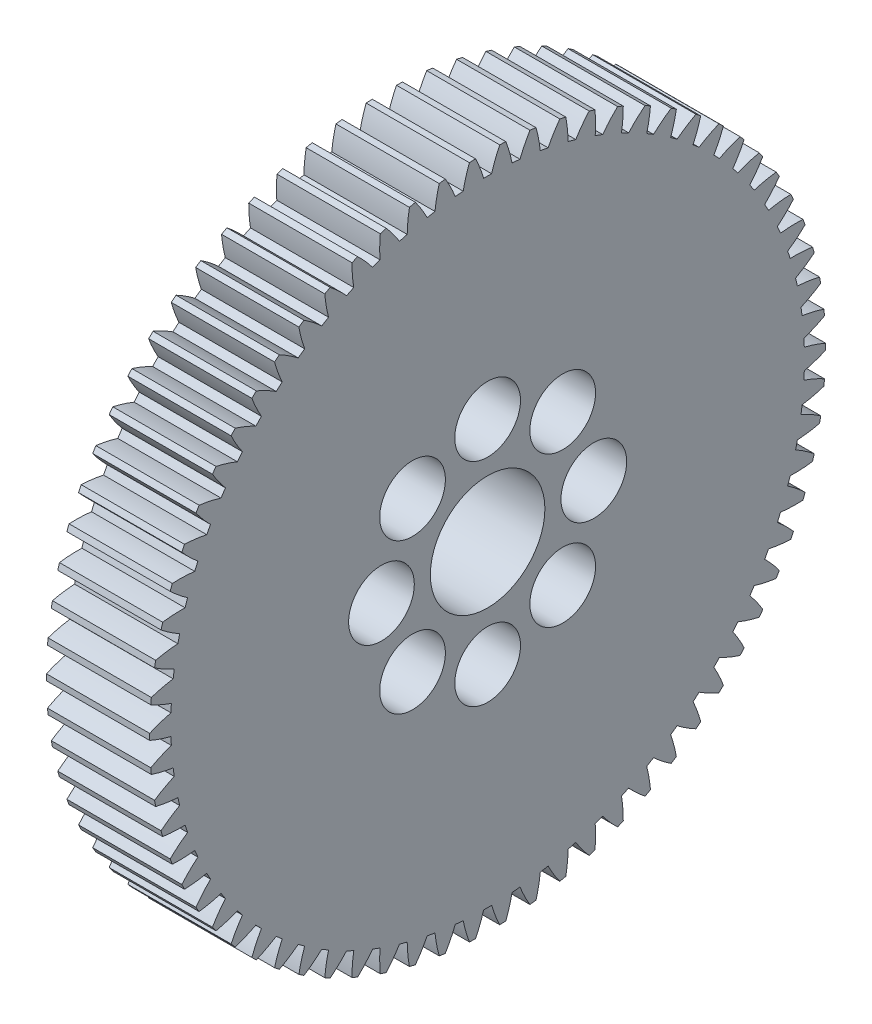
from build123d import *

# Parameters (mm, degrees)
SKETCH1_R           = 4
BOSS_EXTRUDE1_DEPTH = 6
SKETCH2_R           = 16
BOSS_EXTRUDE2_DEPTH = 12
CUT_EXTRUDE1_REACH  = 57.34
SKETCH3_R           = 6.1
CUT_EXTRUDE2_REACH  = 57.34
SKETCH4_R           = 2.1
SKETCH5_R           = 3.5
CUT_EXTRUDE3_DEPTH  = 4
SKETCH6_R           = 3.5
BOSS_EXTRUDE3_DEPTH = 5
SKETCH7_R           = 6.1
CUT_EXTRUDE4_DEPTH  = 10


with BuildPart() as part:
    # Sketch1 → Boss-Extrude1 (new body)
    with BuildSketch(Plane(origin=(10.107991725, 0, 0), x_dir=(0, 0, -1), z_dir=(1, 0, 0))):
        with BuildLine():
            ThreePointArc((-32.575364263, 13.320509527), (-31.755320174, 12.44838645), (-30.863768845, 11.649507738))
            ThreePointArc((-30.863768845, 11.649507738), (-31.033142796, 11.260036996), (-31.197602236, 10.868465692))
            ThreePointArc((-31.197602236, 10.868465692), (-32.391145489, 10.960799175), (-33.58821341, 10.950831147))
            ThreePointArc((-33.58821341, 10.950831147), (-33.704455343, 10.64532887), (-33.817918639, 10.338783753))
            ThreePointArc((-33.817918639, 10.338783753), (-32.922999297, 9.543679773), (-31.963426155, 8.827935157))
            ThreePointArc((-31.963426155, 8.827935157), (-32.097206368, 8.424849746), (-32.225903562, 8.020112763))
            ThreePointArc((-32.225903562, 8.020112763), (-33.422918671, 8.005086146), (-34.614274021, 7.887853905))
            ThreePointArc((-34.614274021, 7.887853905), (-34.702662985, 7.573161644), (-34.788191019, 7.257679816))
            ThreePointArc((-34.788191019, 7.257679816), (-33.825601787, 6.545996642), (-32.805732753, 5.919148876))
            ThreePointArc((-32.805732753, 5.919148876), (-32.902842108, 5.505694203), (-32.994740862, 5.091050244))
            ThreePointArc((-32.994740862, 5.091050244), (-34.185590164, 4.968784513), (-35.36164085, 4.745231944))
            ThreePointArc((-35.36164085, 4.745231944), (-35.42146519, 4.423883416), (-35.47836934, 4.102004952))
            ThreePointArc((-35.47836934, 4.102004952), (-34.455860422, 3.479472638), (-33.383906879, 2.946568733))
            ThreePointArc((-33.383906879, 2.946568733), (-33.44356351, 2.526073691), (-33.497923908, 2.104861226))
            ThreePointArc((-33.497923908, 2.104861226), (-34.673019385, 1.876340792), (-35.82429654, 1.54826781))
            ThreePointArc((-35.82429654, 1.54826781), (-35.855074584, 1.222850324), (-35.882896691, 0.897166799))
            ThreePointArc((-35.882896691, 0.897166799), (-34.808700727, 0.36879761), (-33.693293417, -0.065871806))
            ThreePointArc((-33.693293417, -0.065871806), (-33.715017003, -0.490021637), (-33.731401367, -0.914411253))
            ThreePointArc((-33.731401367, -0.914411253), (-34.881281842, -1.247346478), (-35.998516058, -1.677298424))
            ThreePointArc((-35.998516058, -1.677298424), (-36, -2.004164797), (-35.998516058, -2.33103117))
            ThreePointArc((-35.998516058, -2.33103117), (-34.881281842, -2.760983116), (-33.731401367, -3.09391834))
            ThreePointArc((-33.731401367, -3.09391834), (-33.715017003, -3.518307956), (-33.693293417, -3.942457788))
            ThreePointArc((-33.693293417, -3.942457788), (-34.808700727, -4.377127204), (-35.882896691, -4.905496392))
            ThreePointArc((-35.882896691, -4.905496392), (-35.855074584, -5.231179917), (-35.82429654, -5.556597403))
            ThreePointArc((-35.82429654, -5.556597403), (-34.673019385, -5.884670386), (-33.497923908, -6.11319082))
            ThreePointArc((-33.497923908, -6.11319082), (-33.44356351, -6.534403285), (-33.383906879, -6.954898327))
            ThreePointArc((-33.383906879, -6.954898327), (-34.455860422, -7.487802232), (-35.47836934, -8.110334545))
            ThreePointArc((-35.47836934, -8.110334545), (-35.42146519, -8.43221301), (-35.36164085, -8.753561538))
            ThreePointArc((-35.36164085, -8.753561538), (-34.185590164, -8.977114107), (-32.994740862, -9.099379838))
            ThreePointArc((-32.994740862, -9.099379838), (-32.902842108, -9.514023797), (-32.805732753, -9.92747847))
            ThreePointArc((-32.805732753, -9.92747847), (-33.825601787, -10.554326235), (-34.788191019, -11.26600941))
            ThreePointArc((-34.788191019, -11.26600941), (-34.702662985, -11.581491237), (-34.614274021, -11.896183498))
            ThreePointArc((-34.614274021, -11.896183498), (-33.422918671, -12.013415739), (-32.225903562, -12.028442357))
            ThreePointArc((-32.225903562, -12.028442357), (-32.097206368, -12.43317934), (-31.963426155, -12.836264751))
            ThreePointArc((-31.963426155, -12.836264751), (-32.922999297, -13.552009367), (-33.817918639, -14.347113347))
            ThreePointArc((-33.817918639, -14.347113347), (-33.704455343, -14.653658464), (-33.58821341, -14.959160741))
            ThreePointArc((-33.58821341, -14.959160741), (-32.391145489, -14.969128769), (-31.197602236, -14.876795286))
            ThreePointArc((-31.197602236, -14.876795286), (-31.033142796, -15.26836659), (-30.863768845, -15.657837331))
            ThreePointArc((-30.863768845, -15.657837331), (-31.755320174, -16.456716043), (-32.575364263, -17.32883912))
            ThreePointArc((-32.575364263, -17.32883912), (-32.434879244, -17.623979405), (-32.291720255, -17.917831973))
            ThreePointArc((-32.291720255, -17.917831973), (-31.09857785, -17.820455532), (-29.918116161, -17.621505364))
            ThreePointArc((-29.918116161, -17.621505364), (-29.719218605, -17.996758287), (-29.515614615, -18.369478569))
            ThreePointArc((-29.515614615, -18.369478569), (-30.331965886, -19.245059275), (-31.070532208, -20.187179627))
            ThreePointArc((-31.070532208, -20.187179627), (-30.90415657, -20.468538783), (-30.735233155, -20.748375715))
            ThreePointArc((-30.735233155, -20.748375715), (-29.555622747, -20.544438822), (-28.397747005, -20.240473799))
            ThreePointArc((-28.397747005, -20.240473799), (-28.16601274, -20.596387024), (-27.929818012, -20.949355923))
            ThreePointArc((-27.929818012, -20.949355923), (-28.664396442, -21.894588963), (-29.315538497, -22.899121189))
            ThreePointArc((-29.315538497, -22.899121189), (-29.124611797, -23.164433879), (-28.931284029, -23.428002091))
            ThreePointArc((-28.931284029, -23.428002091), (-27.774703149, -23.119146727), (-26.648735889, -22.712614196))
            ThreePointArc((-26.648735889, -22.712614196), (-26.386030702, -23.04632212), (-26.119146936, -23.376697738))
            ThreePointArc((-26.119146936, -23.376697738), (-26.766038134, -24.38397265), (-27.324513307, -25.442828849))
            ThreePointArc((-27.324513307, -25.442828849), (-27.110572776, -25.689958931), (-26.894397216, -25.935136327))
            ThreePointArc((-26.894397216, -25.935136327), (-25.770157972, -25.523849212), (-24.68516482, -25.018022335))
            ThreePointArc((-24.68516482, -25.018022335), (-24.393603859, -25.326838138), (-24.098179847, -25.631960484))
            ThreePointArc((-24.098179847, -25.631960484), (-24.652175424, -26.693167283), (-25.113487202, -27.797822167))
            ThreePointArc((-25.113487202, -27.797822167), (-24.878255364, -28.024779895), (-24.640972531, -28.249592451))
            ThreePointArc((-24.640972531, -28.249592451), (-23.558126636, -27.739185028), (-22.522843319, -27.138136426))
            ThreePointArc((-22.522843319, -27.138136426), (-22.204774062, -27.419573703), (-21.883188383, -27.696986113))
            ThreePointArc((-21.883188383, -27.696986113), (-22.339827893, -28.803580586), (-22.700262065, -29.945140123))
            ThreePointArc((-22.700262065, -29.945140123), (-22.445632867, -30.150098166), (-22.189153223, -30.352735823))
            ThreePointArc((-22.189153223, -30.352735823), (-21.156419116, -29.747317594), (-20.179181127, -29.055886555))
            ThreePointArc((-20.179181127, -29.055886555), (-19.83716448, -29.30767934), (-19.492006354, -29.555148251))
            ThreePointArc((-19.492006354, -29.555148251), (-19.847613203, -30.69822075), (-20.104267766, -31.867493774))
            ThreePointArc((-20.104267766, -31.867493774), (-19.832291332, -32.048801931), (-19.5586799, -32.227633171))
            ThreePointArc((-19.5586799, -32.227633171), (-18.584372549, -31.532078605), (-17.673048033, -30.755832126))
            ThreePointArc((-17.673048033, -30.755832126), (-17.309837713, -30.975953132), (-16.943886151, -31.19148607))
            ThreePointArc((-16.943886151, -31.19148607), (-17.195597202, -32.361833248), (-17.346405723, -33.54940546))
            ThreePointArc((-17.346405723, -33.54940546), (-17.059271849, -33.705603944), (-16.770731588, -33.859188922))
            ThreePointArc((-16.770731588, -33.859188922), (-15.862695541, -33.079098217), (-15.024621948, -32.224286178))
            ThreePointArc((-15.024621948, -32.224286178), (-14.643142311, -32.41096312), (-14.259343739, -32.59282474))
            ThreePointArc((-14.259343739, -32.59282474), (-14.405132363, -33.781023649), (-14.448880621, -34.977333416))
            ThreePointArc((-14.448880621, -34.977333416), (-14.14890114, -35.107164609), (-13.847755205, -35.23426675))
            ThreePointArc((-13.847755205, -35.23426675), (-13.013301437, -34.375920737), (-12.255226442, -33.449425582))
            ThreePointArc((-12.255226442, -33.449425582), (-11.858548938, -33.601155446), (-11.459993475, -33.747881507))
            ThreePointArc((-11.459993475, -33.747881507), (-11.498685869, -34.944365467), (-11.435021629, -36.139780806))
            ThreePointArc((-11.435021629, -36.139780806), (-11.124611797, -36.242199384), (-10.81328484, -36.341795335))
            ThreePointArc((-10.81328484, -36.341795335), (-10.059131881, -35.412104912), (-9.387159058, -34.421386236))
            ThreePointArc((-9.387159058, -34.421386236), (-8.978477501, -34.536947383), (-8.568374083, -34.647356531))
            ThreePointArc((-8.568374083, -34.647356531), (-8.499658717, -35.842492158), (-8.329094565, -37.027388288))
            ThreePointArc((-8.329094565, -37.027388288), (-8.010753622, -37.101569635), (-7.691752263, -37.17285751))
            ThreePointArc((-7.691752263, -37.17285751), (-7.023972109, -36.179307997), (-6.443511789, -35.132342483))
            ThreePointArc((-6.443511789, -35.132342483), (-6.026116643, -35.210804483), (-5.607767181, -35.284007769))
            ThreePointArc((-5.607767181, -35.284007769), (-5.432197311, -36.468172534), (-5.15610653, -37.633009368))
            ThreePointArc((-5.15610653, -37.633009368), (-4.832397569, -37.678356221), (-4.50829022, -37.720762049))
            ThreePointArc((-4.50829022, -37.720762049), (-3.932259444, -36.671352923), (-3.447985152, -35.576570123))
            ThreePointArc((-3.447985152, -35.576570123), (-3.025237036, -35.617301245), (-2.602009834, -35.65270928))
            ThreePointArc((-2.602009834, -35.65270928), (-2.320999046, -36.816368984), (-1.941604556, -37.95176794))
            ThreePointArc((-1.941604556, -37.95176794), (-1.615133893, -37.967915192), (-1.288530075, -37.981097549))
            ThreePointArc((-1.288530075, -37.981097549), (-0.808886539, -36.884278035), (-0.424697366, -35.750492496))
            ThreePointArc((-0.424697366, -35.750492496), (0, -35.753164797), (0.424697366, -35.750492496))
            ThreePointArc((0.424697366, -35.750492496), (0.808886539, -36.884278035), (1.288530075, -37.981097549))
            ThreePointArc((1.288530075, -37.981097549), (1.615133893, -37.967915192), (1.941604556, -37.95176794))
            ThreePointArc((1.941604556, -37.95176794), (2.320999046, -36.816368984), (2.602009834, -35.65270928))
            ThreePointArc((2.602009834, -35.65270928), (3.025237036, -35.617301245), (3.447985152, -35.576570123))
            ThreePointArc((3.447985152, -35.576570123), (3.932259444, -36.671352923), (4.50829022, -37.720762049))
            ThreePointArc((4.50829022, -37.720762049), (4.832397569, -37.678356221), (5.15610653, -37.633009368))
            ThreePointArc((5.15610653, -37.633009368), (5.432197311, -36.468172534), (5.607767181, -35.284007769))
            ThreePointArc((5.607767181, -35.284007769), (6.026116643, -35.210804483), (6.443511789, -35.132342483))
            ThreePointArc((6.443511789, -35.132342483), (7.023972109, -36.179307997), (7.691752263, -37.17285751))
            ThreePointArc((7.691752263, -37.17285751), (8.010753622, -37.101569635), (8.329094565, -37.027388288))
            ThreePointArc((8.329094565, -37.027388288), (8.499658717, -35.842492158), (8.568374083, -34.647356531))
            ThreePointArc((8.568374083, -34.647356531), (8.978477501, -34.536947383), (9.387159058, -34.421386236))
            ThreePointArc((9.387159058, -34.421386236), (10.059131881, -35.412104912), (10.81328484, -36.341795335))
            ThreePointArc((10.81328484, -36.341795335), (11.124611797, -36.242199384), (11.435021629, -36.139780806))
            ThreePointArc((11.435021629, -36.139780806), (11.498685869, -34.944365467), (11.459993475, -33.747881507))
            ThreePointArc((11.459993475, -33.747881507), (11.858548938, -33.601155446), (12.255226442, -33.449425582))
            ThreePointArc((12.255226442, -33.449425582), (13.013301437, -34.375920737), (13.847755205, -35.23426675))
            ThreePointArc((13.847755205, -35.23426675), (14.14890114, -35.107164609), (14.448880621, -34.977333416))
            ThreePointArc((14.448880621, -34.977333416), (14.405132363, -33.781023649), (14.259343739, -32.59282474))
            ThreePointArc((14.259343739, -32.59282474), (14.643142311, -32.41096312), (15.024621948, -32.224286178))
            ThreePointArc((15.024621948, -32.224286178), (15.862695541, -33.079098217), (16.770731588, -33.859188922))
            ThreePointArc((16.770731588, -33.859188922), (17.059271849, -33.705603944), (17.346405723, -33.54940546))
            ThreePointArc((17.346405723, -33.54940546), (17.195597202, -32.361833248), (16.943886151, -31.19148607))
            ThreePointArc((16.943886151, -31.19148607), (17.309837713, -30.975953132), (17.673048033, -30.755832126))
            ThreePointArc((17.673048033, -30.755832126), (18.584372549, -31.532078605), (19.5586799, -32.227633171))
            ThreePointArc((19.5586799, -32.227633171), (19.832291332, -32.048801931), (20.104267766, -31.867493774))
            ThreePointArc((20.104267766, -31.867493774), (19.847613203, -30.69822075), (19.492006354, -29.555148251))
            ThreePointArc((19.492006354, -29.555148251), (19.83716448, -29.30767934), (20.179181127, -29.055886555))
            ThreePointArc((20.179181127, -29.055886555), (21.156419116, -29.747317594), (22.189153223, -30.352735823))
            ThreePointArc((22.189153223, -30.352735823), (22.445632867, -30.150098166), (22.700262065, -29.945140123))
            ThreePointArc((22.700262065, -29.945140123), (22.339827893, -28.803580586), (21.883188383, -27.696986113))
            ThreePointArc((21.883188383, -27.696986113), (22.204774062, -27.419573703), (22.522843319, -27.138136426))
            ThreePointArc((22.522843319, -27.138136426), (23.558126636, -27.739185028), (24.640972531, -28.249592451))
            ThreePointArc((24.640972531, -28.249592451), (24.878255364, -28.024779895), (25.113487202, -27.797822167))
            ThreePointArc((25.113487202, -27.797822167), (24.652175424, -26.693167283), (24.098179847, -25.631960484))
            ThreePointArc((24.098179847, -25.631960484), (24.393603859, -25.326838138), (24.68516482, -25.018022335))
            ThreePointArc((24.68516482, -25.018022335), (25.770157972, -25.523849212), (26.894397216, -25.935136327))
            ThreePointArc((26.894397216, -25.935136327), (27.110572776, -25.689958931), (27.324513307, -25.442828849))
            ThreePointArc((27.324513307, -25.442828849), (26.766038134, -24.38397265), (26.119146936, -23.376697738))
            ThreePointArc((26.119146936, -23.376697738), (26.386030702, -23.04632212), (26.648735889, -22.712614196))
            ThreePointArc((26.648735889, -22.712614196), (27.774703149, -23.119146727), (28.931284029, -23.428002091))
            ThreePointArc((28.931284029, -23.428002091), (29.124611797, -23.164433879), (29.315538497, -22.899121189))
            ThreePointArc((29.315538497, -22.899121189), (28.664396442, -21.894588963), (27.929818012, -20.949355923))
            ThreePointArc((27.929818012, -20.949355923), (28.16601274, -20.596387024), (28.397747005, -20.240473799))
            ThreePointArc((28.397747005, -20.240473799), (29.555622747, -20.544438822), (30.735233155, -20.748375715))
            ThreePointArc((30.735233155, -20.748375715), (30.90415657, -20.468538783), (31.070532208, -20.187179627))
            ThreePointArc((31.070532208, -20.187179627), (30.331965886, -19.245059275), (29.515614615, -18.369478569))
            ThreePointArc((29.515614615, -18.369478569), (29.719218605, -17.996758287), (29.918116161, -17.621505364))
            ThreePointArc((29.918116161, -17.621505364), (31.09857785, -17.820455532), (32.291720255, -17.917831973))
            ThreePointArc((32.291720255, -17.917831973), (32.434879244, -17.623979405), (32.575364263, -17.32883912))
            ThreePointArc((32.575364263, -17.32883912), (31.755320174, -16.456716043), (30.863768845, -15.657837331))
            ThreePointArc((30.863768845, -15.657837331), (31.033142796, -15.26836659), (31.197602236, -14.876795286))
            ThreePointArc((31.197602236, -14.876795286), (32.391145489, -14.969128769), (33.58821341, -14.959160741))
            ThreePointArc((33.58821341, -14.959160741), (33.704455343, -14.653658464), (33.817918639, -14.347113347))
            ThreePointArc((33.817918639, -14.347113347), (32.922999297, -13.552009367), (31.963426155, -12.836264751))
            ThreePointArc((31.963426155, -12.836264751), (32.097206368, -12.43317934), (32.225903562, -12.028442357))
            ThreePointArc((32.225903562, -12.028442357), (33.422918671, -12.013415739), (34.614274021, -11.896183498))
            ThreePointArc((34.614274021, -11.896183498), (34.702662985, -11.581491237), (34.788191019, -11.26600941))
            ThreePointArc((34.788191019, -11.26600941), (33.825601787, -10.554326235), (32.805732753, -9.92747847))
            ThreePointArc((32.805732753, -9.92747847), (32.902842108, -9.514023797), (32.994740862, -9.099379838))
            ThreePointArc((32.994740862, -9.099379838), (34.185590164, -8.977114107), (35.36164085, -8.753561538))
            ThreePointArc((35.36164085, -8.753561538), (35.42146519, -8.43221301), (35.47836934, -8.110334545))
            ThreePointArc((35.47836934, -8.110334545), (34.455860422, -7.487802232), (33.383906879, -6.954898327))
            ThreePointArc((33.383906879, -6.954898327), (33.44356351, -6.534403285), (33.497923908, -6.11319082))
            ThreePointArc((33.497923908, -6.11319082), (34.673019385, -5.884670386), (35.82429654, -5.556597403))
            ThreePointArc((35.82429654, -5.556597403), (35.855074584, -5.231179917), (35.882896691, -4.905496392))
            ThreePointArc((35.882896691, -4.905496392), (34.808700727, -4.377127204), (33.693293417, -3.942457788))
            ThreePointArc((33.693293417, -3.942457788), (33.715017003, -3.518307956), (33.731401367, -3.09391834))
            ThreePointArc((33.731401367, -3.09391834), (34.881281842, -2.760983116), (35.998516058, -2.33103117))
            ThreePointArc((35.998516058, -2.33103117), (36, -2.004164797), (35.998516058, -1.677298424))
            ThreePointArc((35.998516058, -1.677298424), (34.881281842, -1.247346478), (33.731401367, -0.914411253))
            ThreePointArc((33.731401367, -0.914411253), (33.715017003, -0.490021637), (33.693293417, -0.065871806))
            ThreePointArc((33.693293417, -0.065871806), (34.808700727, 0.36879761), (35.882896691, 0.897166799))
            ThreePointArc((35.882896691, 0.897166799), (35.855074584, 1.222850324), (35.82429654, 1.54826781))
            ThreePointArc((35.82429654, 1.54826781), (34.673019385, 1.876340792), (33.497923908, 2.104861226))
            ThreePointArc((33.497923908, 2.104861226), (33.44356351, 2.526073691), (33.383906879, 2.946568733))
            ThreePointArc((33.383906879, 2.946568733), (34.455860422, 3.479472638), (35.47836934, 4.102004952))
            ThreePointArc((35.47836934, 4.102004952), (35.42146519, 4.423883416), (35.36164085, 4.745231944))
            ThreePointArc((35.36164085, 4.745231944), (34.185590164, 4.968784513), (32.994740862, 5.091050244))
            ThreePointArc((32.994740862, 5.091050244), (32.902842108, 5.505694203), (32.805732753, 5.919148876))
            ThreePointArc((32.805732753, 5.919148876), (33.825601787, 6.545996642), (34.788191019, 7.257679816))
            ThreePointArc((34.788191019, 7.257679816), (34.702662985, 7.573161644), (34.614274021, 7.887853905))
            ThreePointArc((34.614274021, 7.887853905), (33.422918671, 8.005086146), (32.225903562, 8.020112763))
            ThreePointArc((32.225903562, 8.020112763), (32.097206368, 8.424849746), (31.963426155, 8.827935157))
            ThreePointArc((31.963426155, 8.827935157), (32.922999297, 9.543679773), (33.817918639, 10.338783753))
            ThreePointArc((33.817918639, 10.338783753), (33.704455343, 10.64532887), (33.58821341, 10.950831147))
            ThreePointArc((33.58821341, 10.950831147), (32.391145489, 10.960799175), (31.197602236, 10.868465692))
            ThreePointArc((31.197602236, 10.868465692), (31.033142796, 11.260036996), (30.863768845, 11.649507738))
            ThreePointArc((30.863768845, 11.649507738), (31.755320174, 12.44838645), (32.575364263, 13.320509527))
            ThreePointArc((32.575364263, 13.320509527), (32.434879244, 13.615649811), (32.291720255, 13.909502379))
            ThreePointArc((32.291720255, 13.909502379), (31.09857785, 13.812125938), (29.918116161, 13.613175771))
            ThreePointArc((29.918116161, 13.613175771), (29.719218605, 13.988428693), (29.515614615, 14.361148976))
            ThreePointArc((29.515614615, 14.361148976), (30.331965886, 15.236729682), (31.070532208, 16.178850033))
            ThreePointArc((31.070532208, 16.178850033), (30.90415657, 16.46020919), (30.735233155, 16.740046121))
            ThreePointArc((30.735233155, 16.740046121), (29.555622747, 16.536109228), (28.397747005, 16.232144205))
            ThreePointArc((28.397747005, 16.232144205), (28.16601274, 16.58805743), (27.929818012, 16.94102633))
            ThreePointArc((27.929818012, 16.94102633), (28.664396442, 17.886259369), (29.315538497, 18.890791595))
            ThreePointArc((29.315538497, 18.890791595), (29.124611797, 19.156104286), (28.931284029, 19.419672497))
            ThreePointArc((28.931284029, 19.419672497), (27.774703149, 19.110817133), (26.648735889, 18.704284602))
            ThreePointArc((26.648735889, 18.704284602), (26.386030702, 19.037992526), (26.119146936, 19.368368144))
            ThreePointArc((26.119146936, 19.368368144), (26.766038134, 20.375643056), (27.324513307, 21.434499255))
            ThreePointArc((27.324513307, 21.434499255), (27.110572776, 21.681629337), (26.894397216, 21.926806733))
            ThreePointArc((26.894397216, 21.926806733), (25.770157972, 21.515519619), (24.68516482, 21.009692742))
            ThreePointArc((24.68516482, 21.009692742), (24.393603859, 21.318508544), (24.098179847, 21.623630891))
            ThreePointArc((24.098179847, 21.623630891), (24.652175424, 22.68483769), (25.113487202, 23.789492573))
            ThreePointArc((25.113487202, 23.789492573), (24.878255364, 24.016450301), (24.640972531, 24.241262857))
            ThreePointArc((24.640972531, 24.241262857), (23.558126636, 23.730855435), (22.522843319, 23.129806832))
            ThreePointArc((22.522843319, 23.129806832), (22.204774062, 23.411244109), (21.883188383, 23.688656519))
            ThreePointArc((21.883188383, 23.688656519), (22.339827893, 24.795250992), (22.700262065, 25.936810529))
            ThreePointArc((22.700262065, 25.936810529), (22.445632867, 26.141768572), (22.189153223, 26.34440623))
            ThreePointArc((22.189153223, 26.34440623), (21.156419116, 25.738988), (20.179181127, 25.047556961))
            ThreePointArc((20.179181127, 25.047556961), (19.83716448, 25.299349746), (19.492006354, 25.546818657))
            ThreePointArc((19.492006354, 25.546818657), (19.847613203, 26.689891156), (20.104267766, 27.85916418))
            ThreePointArc((20.104267766, 27.85916418), (19.832291332, 28.040472337), (19.5586799, 28.219303577))
            ThreePointArc((19.5586799, 28.219303577), (18.584372549, 27.523749011), (17.673048033, 26.747502533))
            ThreePointArc((17.673048033, 26.747502533), (17.309837713, 26.967623538), (16.943886151, 27.183156476))
            ThreePointArc((16.943886151, 27.183156476), (17.195597202, 28.353503654), (17.346405723, 29.541075866))
            ThreePointArc((17.346405723, 29.541075866), (17.059271849, 29.69727435), (16.770731588, 29.850859328))
            ThreePointArc((16.770731588, 29.850859328), (15.862695541, 29.070768623), (15.024621948, 28.215956585))
            ThreePointArc((15.024621948, 28.215956585), (14.643142311, 28.402633526), (14.259343739, 28.584495147))
            ThreePointArc((14.259343739, 28.584495147), (14.405132363, 29.772694055), (14.448880621, 30.969003822))
            ThreePointArc((14.448880621, 30.969003822), (14.14890114, 31.098835015), (13.847755205, 31.225937156))
            ThreePointArc((13.847755205, 31.225937156), (13.013301437, 30.367591143), (12.255226442, 29.441095989))
            ThreePointArc((12.255226442, 29.441095989), (11.858548938, 29.592825852), (11.459993475, 29.739551913))
            ThreePointArc((11.459993475, 29.739551913), (11.498685869, 30.936035873), (11.435021629, 32.131451213))
            ThreePointArc((11.435021629, 32.131451213), (11.124611797, 32.23386979), (10.81328484, 32.333465741))
            ThreePointArc((10.81328484, 32.333465741), (10.059131881, 31.403775318), (9.387159058, 30.413056642))
            ThreePointArc((9.387159058, 30.413056642), (8.978477501, 30.528617789), (8.568374083, 30.639026937))
            ThreePointArc((8.568374083, 30.639026937), (8.499658717, 31.834162564), (8.329094565, 33.019058694))
            ThreePointArc((8.329094565, 33.019058694), (8.010753622, 33.093240042), (7.691752263, 33.164527916))
            ThreePointArc((7.691752263, 33.164527916), (7.023972109, 32.170978403), (6.443511789, 31.12401289))
            ThreePointArc((6.443511789, 31.12401289), (6.026116643, 31.202474889), (5.607767181, 31.275678175))
            ThreePointArc((5.607767181, 31.275678175), (5.432197311, 32.45984294), (5.15610653, 33.624679774))
            ThreePointArc((5.15610653, 33.624679774), (4.832397569, 33.670026627), (4.50829022, 33.712432456))
            ThreePointArc((4.50829022, 33.712432456), (3.932259444, 32.663023329), (3.447985152, 31.568240529))
            ThreePointArc((3.447985152, 31.568240529), (3.025237036, 31.608971651), (2.602009834, 31.644379686))
            ThreePointArc((2.602009834, 31.644379686), (2.320999046, 32.80803939), (1.941604556, 33.943438346))
            ThreePointArc((1.941604556, 33.943438346), (1.615133893, 33.959585599), (1.288530075, 33.972767955))
            ThreePointArc((1.288530075, 33.972767955), (0.808886539, 32.875948441), (0.424697366, 31.742162902))
            ThreePointArc((0.424697366, 31.742162902), (0, 31.744835203), (-0.424697366, 31.742162902))
            ThreePointArc((-0.424697366, 31.742162902), (-0.808886539, 32.875948441), (-1.288530075, 33.972767955))
            ThreePointArc((-1.288530075, 33.972767955), (-1.615133893, 33.959585599), (-1.941604556, 33.943438346))
            ThreePointArc((-1.941604556, 33.943438346), (-2.320999046, 32.80803939), (-2.602009834, 31.644379686))
            ThreePointArc((-2.602009834, 31.644379686), (-3.025237036, 31.608971651), (-3.447985152, 31.568240529))
            ThreePointArc((-3.447985152, 31.568240529), (-3.932259444, 32.663023329), (-4.50829022, 33.712432456))
            ThreePointArc((-4.50829022, 33.712432456), (-4.832397569, 33.670026627), (-5.15610653, 33.624679774))
            ThreePointArc((-5.15610653, 33.624679774), (-5.432197311, 32.45984294), (-5.607767181, 31.275678175))
            ThreePointArc((-5.607767181, 31.275678175), (-6.026116643, 31.202474889), (-6.443511789, 31.12401289))
            ThreePointArc((-6.443511789, 31.12401289), (-7.023972109, 32.170978403), (-7.691752263, 33.164527916))
            ThreePointArc((-7.691752263, 33.164527916), (-8.010753622, 33.093240042), (-8.329094565, 33.019058694))
            ThreePointArc((-8.329094565, 33.019058694), (-8.499658717, 31.834162564), (-8.568374083, 30.639026937))
            ThreePointArc((-8.568374083, 30.639026937), (-8.978477501, 30.528617789), (-9.387159058, 30.413056642))
            ThreePointArc((-9.387159058, 30.413056642), (-10.059131881, 31.403775318), (-10.81328484, 32.333465741))
            ThreePointArc((-10.81328484, 32.333465741), (-11.124611797, 32.23386979), (-11.435021629, 32.131451213))
            ThreePointArc((-11.435021629, 32.131451213), (-11.498685869, 30.936035873), (-11.459993475, 29.739551913))
            ThreePointArc((-11.459993475, 29.739551913), (-11.858548938, 29.592825852), (-12.255226442, 29.441095989))
            ThreePointArc((-12.255226442, 29.441095989), (-13.013301437, 30.367591143), (-13.847755205, 31.225937156))
            ThreePointArc((-13.847755205, 31.225937156), (-14.14890114, 31.098835015), (-14.448880621, 30.969003822))
            ThreePointArc((-14.448880621, 30.969003822), (-14.405132363, 29.772694055), (-14.259343739, 28.584495147))
            ThreePointArc((-14.259343739, 28.584495147), (-14.643142311, 28.402633526), (-15.024621948, 28.215956585))
            ThreePointArc((-15.024621948, 28.215956585), (-15.862695541, 29.070768623), (-16.770731588, 29.850859328))
            ThreePointArc((-16.770731588, 29.850859328), (-17.059271849, 29.69727435), (-17.346405723, 29.541075866))
            ThreePointArc((-17.346405723, 29.541075866), (-17.195597202, 28.353503654), (-16.943886151, 27.183156476))
            ThreePointArc((-16.943886151, 27.183156476), (-17.309837713, 26.967623538), (-17.673048033, 26.747502533))
            ThreePointArc((-17.673048033, 26.747502533), (-18.584372549, 27.523749011), (-19.5586799, 28.219303577))
            ThreePointArc((-19.5586799, 28.219303577), (-19.832291332, 28.040472337), (-20.104267766, 27.85916418))
            ThreePointArc((-20.104267766, 27.85916418), (-19.847613203, 26.689891156), (-19.492006354, 25.546818657))
            ThreePointArc((-19.492006354, 25.546818657), (-19.83716448, 25.299349746), (-20.179181127, 25.047556961))
            ThreePointArc((-20.179181127, 25.047556961), (-21.156419116, 25.738988), (-22.189153223, 26.34440623))
            ThreePointArc((-22.189153223, 26.34440623), (-22.445632867, 26.141768572), (-22.700262065, 25.936810529))
            ThreePointArc((-22.700262065, 25.936810529), (-22.339827893, 24.795250992), (-21.883188383, 23.688656519))
            ThreePointArc((-21.883188383, 23.688656519), (-22.204774062, 23.411244109), (-22.522843319, 23.129806832))
            ThreePointArc((-22.522843319, 23.129806832), (-23.558126636, 23.730855435), (-24.640972531, 24.241262857))
            ThreePointArc((-24.640972531, 24.241262857), (-24.878255364, 24.016450301), (-25.113487202, 23.789492573))
            ThreePointArc((-25.113487202, 23.789492573), (-24.652175424, 22.68483769), (-24.098179847, 21.623630891))
            ThreePointArc((-24.098179847, 21.623630891), (-24.393603859, 21.318508544), (-24.68516482, 21.009692742))
            ThreePointArc((-24.68516482, 21.009692742), (-25.770157972, 21.515519619), (-26.894397216, 21.926806733))
            ThreePointArc((-26.894397216, 21.926806733), (-27.110572776, 21.681629337), (-27.324513307, 21.434499255))
            ThreePointArc((-27.324513307, 21.434499255), (-26.766038134, 20.375643056), (-26.119146936, 19.368368144))
            ThreePointArc((-26.119146936, 19.368368144), (-26.386030702, 19.037992526), (-26.648735889, 18.704284602))
            ThreePointArc((-26.648735889, 18.704284602), (-27.774703149, 19.110817133), (-28.931284029, 19.419672497))
            ThreePointArc((-28.931284029, 19.419672497), (-29.124611797, 19.156104286), (-29.315538497, 18.890791595))
            ThreePointArc((-29.315538497, 18.890791595), (-28.664396442, 17.886259369), (-27.929818012, 16.94102633))
            ThreePointArc((-27.929818012, 16.94102633), (-28.16601274, 16.58805743), (-28.397747005, 16.232144205))
            ThreePointArc((-28.397747005, 16.232144205), (-29.555622747, 16.536109228), (-30.735233155, 16.740046121))
            ThreePointArc((-30.735233155, 16.740046121), (-30.90415657, 16.46020919), (-31.070532208, 16.178850033))
            ThreePointArc((-31.070532208, 16.178850033), (-30.331965886, 15.236729682), (-29.515614615, 14.361148976))
            ThreePointArc((-29.515614615, 14.361148976), (-29.719218605, 13.988428693), (-29.918116161, 13.613175771))
            ThreePointArc((-29.918116161, 13.613175771), (-31.09857785, 13.812125938), (-32.291720255, 13.909502379))
            ThreePointArc((-32.291720255, 13.909502379), (-32.434879244, 13.615649811), (-32.575364263, 13.320509527))
        make_face()
        with Locations((0, -2.004164797)):
            Circle(SKETCH1_R, mode=Mode.SUBTRACT)
    extrude(amount=-BOSS_EXTRUDE1_DEPTH)

    # Sketch2 → Boss-Extrude2 (add)
    with BuildSketch(Plane.ZY.offset(-4.107991725)):
        with Locations((0, -2.004164797)):
            Circle(SKETCH2_R)
    extrude(amount=BOSS_EXTRUDE2_DEPTH)

    # Sketch3 → Cut-Extrude1 (cut, up to next)
    with BuildSketch(Plane.ZY.offset(7.892008275), mode=Mode.PRIVATE) as cut_extrude1_sk1:
        with Locations((0, -2.004164797)):
            Circle(SKETCH3_R)
    cut_extrude1_tool1 = extrude(cut_extrude1_sk1.sketch, amount=-CUT_EXTRUDE1_REACH, mode=Mode.PRIVATE) & part.part
    add(cut_extrude1_tool1.solids().sort_by_distance((-7.892008, -2.004165, 0))[0], mode=Mode.SUBTRACT)

    # Sketch4 → Cut-Extrude2 (cut, up to next)
    with BuildSketch(Plane.ZY.offset(7.892008275), mode=Mode.PRIVATE) as cut_extrude2_sk1:
        with Locations((11.31, -2.004164797)):
            Circle(SKETCH4_R)
    cut_extrude2_tool1 = extrude(cut_extrude2_sk1.sketch, amount=-CUT_EXTRUDE2_REACH, mode=Mode.PRIVATE) & part.part
    # Sketch4 → Cut-Extrude2 (cut, up to next)
    with BuildSketch(Plane.ZY.offset(7.892008275), mode=Mode.PRIVATE) as cut_extrude2_sk2:
        with Locations((7.997377695, -10.001542492)):
            Circle(SKETCH4_R)
    cut_extrude2_tool2 = extrude(cut_extrude2_sk2.sketch, amount=-CUT_EXTRUDE2_REACH, mode=Mode.PRIVATE) & part.part
    # Sketch4 → Cut-Extrude2 (cut, up to next)
    with BuildSketch(Plane.ZY.offset(7.892008275), mode=Mode.PRIVATE) as cut_extrude2_sk3:
        with Locations((0, -13.314164797)):
            Circle(SKETCH4_R)
    cut_extrude2_tool3 = extrude(cut_extrude2_sk3.sketch, amount=-CUT_EXTRUDE2_REACH, mode=Mode.PRIVATE) & part.part
    # Sketch4 → Cut-Extrude2 (cut, up to next)
    with BuildSketch(Plane.ZY.offset(7.892008275), mode=Mode.PRIVATE) as cut_extrude2_sk4:
        with Locations((-7.997377695, -10.001542492)):
            Circle(SKETCH4_R)
    cut_extrude2_tool4 = extrude(cut_extrude2_sk4.sketch, amount=-CUT_EXTRUDE2_REACH, mode=Mode.PRIVATE) & part.part
    # Sketch4 → Cut-Extrude2 (cut, up to next)
    with BuildSketch(Plane.ZY.offset(7.892008275), mode=Mode.PRIVATE) as cut_extrude2_sk5:
        with Locations((-11.31, -2.004164797)):
            Circle(SKETCH4_R)
    cut_extrude2_tool5 = extrude(cut_extrude2_sk5.sketch, amount=-CUT_EXTRUDE2_REACH, mode=Mode.PRIVATE) & part.part
    # Sketch4 → Cut-Extrude2 (cut, up to next)
    with BuildSketch(Plane.ZY.offset(7.892008275), mode=Mode.PRIVATE) as cut_extrude2_sk6:
        with Locations((-7.997377695, 5.993212898)):
            Circle(SKETCH4_R)
    cut_extrude2_tool6 = extrude(cut_extrude2_sk6.sketch, amount=-CUT_EXTRUDE2_REACH, mode=Mode.PRIVATE) & part.part
    # Sketch4 → Cut-Extrude2 (cut, up to next)
    with BuildSketch(Plane.ZY.offset(7.892008275), mode=Mode.PRIVATE) as cut_extrude2_sk7:
        with Locations((0, 9.305835203)):
            Circle(SKETCH4_R)
    cut_extrude2_tool7 = extrude(cut_extrude2_sk7.sketch, amount=-CUT_EXTRUDE2_REACH, mode=Mode.PRIVATE) & part.part
    # Sketch4 → Cut-Extrude2 (cut, up to next)
    with BuildSketch(Plane.ZY.offset(7.892008275), mode=Mode.PRIVATE) as cut_extrude2_sk8:
        with Locations((7.997377695, 5.993212898)):
            Circle(SKETCH4_R)
    cut_extrude2_tool8 = extrude(cut_extrude2_sk8.sketch, amount=-CUT_EXTRUDE2_REACH, mode=Mode.PRIVATE) & part.part
    add(cut_extrude2_tool1.solids().sort_by_distance((-7.892008, -2.004165, 11.31))[0], mode=Mode.SUBTRACT)
    add(cut_extrude2_tool2.solids().sort_by_distance((-7.892008, -10.001542, 7.997378))[0], mode=Mode.SUBTRACT)
    add(cut_extrude2_tool3.solids().sort_by_distance((-7.892008, -13.314165, 0))[0], mode=Mode.SUBTRACT)
    add(cut_extrude2_tool4.solids().sort_by_distance((-7.892008, -10.001542, -7.997378))[0], mode=Mode.SUBTRACT)
    add(cut_extrude2_tool5.solids().sort_by_distance((-7.892008, -2.004165, -11.31))[0], mode=Mode.SUBTRACT)
    add(cut_extrude2_tool6.solids().sort_by_distance((-7.892008, 5.993213, -7.997378))[0], mode=Mode.SUBTRACT)
    add(cut_extrude2_tool7.solids().sort_by_distance((-7.892008, 9.305835, 0))[0], mode=Mode.SUBTRACT)
    add(cut_extrude2_tool8.solids().sort_by_distance((-7.892008, 5.993213, 7.997378))[0], mode=Mode.SUBTRACT)

    # Sketch5 → Cut-Extrude3 (cut)
    with BuildSketch(Plane(origin=(10.107991725, 0, 0), x_dir=(0, 0, -1), z_dir=(1, 0, 0))):
        with Locations((0, 9.305835203)):
            Circle(SKETCH5_R)
        with Locations((7.997377695, 5.993212898)):
            Circle(SKETCH5_R)
        with Locations((11.31, -2.004164797)):
            Circle(SKETCH5_R)
        with Locations((7.997377695, -10.001542492)):
            Circle(SKETCH5_R)
        with Locations((0, -13.314164797)):
            Circle(SKETCH5_R)
        with Locations((-7.997377695, -10.001542492)):
            Circle(SKETCH5_R)
        with Locations((-11.31, -2.004164797)):
            Circle(SKETCH5_R)
        with Locations((-7.997377695, 5.993212898)):
            Circle(SKETCH5_R)
    extrude(amount=-CUT_EXTRUDE3_DEPTH, mode=Mode.SUBTRACT)

    # Sketch6 → Boss-Extrude3 (add)
    with BuildSketch(Plane(origin=(10.107991725, 0, 0), x_dir=(0, 0, -1), z_dir=(1, 0, 0))):
        with BuildLine():
            ThreePointArc((-32.575364263, 13.320509527), (-31.755320174, 12.44838645), (-30.863768845, 11.649507738))
            ThreePointArc((-30.863768845, 11.649507738), (-31.033142796, 11.260036996), (-31.197602236, 10.868465692))
            ThreePointArc((-31.197602236, 10.868465692), (-32.391145489, 10.960799175), (-33.58821341, 10.950831147))
            ThreePointArc((-33.58821341, 10.950831147), (-33.704455343, 10.64532887), (-33.817918639, 10.338783753))
            ThreePointArc((-33.817918639, 10.338783753), (-32.922999297, 9.543679773), (-31.963426155, 8.827935157))
            ThreePointArc((-31.963426155, 8.827935157), (-32.097206368, 8.424849746), (-32.225903562, 8.020112763))
            ThreePointArc((-32.225903562, 8.020112763), (-33.422918671, 8.005086146), (-34.614274021, 7.887853905))
            ThreePointArc((-34.614274021, 7.887853905), (-34.702662985, 7.573161644), (-34.788191019, 7.257679816))
            ThreePointArc((-34.788191019, 7.257679816), (-33.825601787, 6.545996642), (-32.805732753, 5.919148876))
            ThreePointArc((-32.805732753, 5.919148876), (-32.902842108, 5.505694203), (-32.994740862, 5.091050244))
            ThreePointArc((-32.994740862, 5.091050244), (-34.185590164, 4.968784513), (-35.36164085, 4.745231944))
            ThreePointArc((-35.36164085, 4.745231944), (-35.42146519, 4.423883416), (-35.47836934, 4.102004952))
            ThreePointArc((-35.47836934, 4.102004952), (-34.455860422, 3.479472638), (-33.383906879, 2.946568733))
            ThreePointArc((-33.383906879, 2.946568733), (-33.44356351, 2.526073691), (-33.497923908, 2.104861226))
            ThreePointArc((-33.497923908, 2.104861226), (-34.673019385, 1.876340792), (-35.82429654, 1.54826781))
            ThreePointArc((-35.82429654, 1.54826781), (-35.855074584, 1.222850324), (-35.882896691, 0.897166799))
            ThreePointArc((-35.882896691, 0.897166799), (-34.808700727, 0.36879761), (-33.693293417, -0.065871806))
            ThreePointArc((-33.693293417, -0.065871806), (-33.715017003, -0.490021637), (-33.731401367, -0.914411253))
            ThreePointArc((-33.731401367, -0.914411253), (-34.881281842, -1.247346478), (-35.998516058, -1.677298424))
            ThreePointArc((-35.998516058, -1.677298424), (-36, -2.004164797), (-35.998516058, -2.33103117))
            ThreePointArc((-35.998516058, -2.33103117), (-34.881281842, -2.760983116), (-33.731401367, -3.09391834))
            ThreePointArc((-33.731401367, -3.09391834), (-33.715017003, -3.518307956), (-33.693293417, -3.942457788))
            ThreePointArc((-33.693293417, -3.942457788), (-34.808700727, -4.377127204), (-35.882896691, -4.905496392))
            ThreePointArc((-35.882896691, -4.905496392), (-35.855074584, -5.231179917), (-35.82429654, -5.556597403))
            ThreePointArc((-35.82429654, -5.556597403), (-34.673019385, -5.884670386), (-33.497923908, -6.11319082))
            ThreePointArc((-33.497923908, -6.11319082), (-33.44356351, -6.534403285), (-33.383906879, -6.954898327))
            ThreePointArc((-33.383906879, -6.954898327), (-34.455860422, -7.487802232), (-35.47836934, -8.110334545))
            ThreePointArc((-35.47836934, -8.110334545), (-35.42146519, -8.43221301), (-35.36164085, -8.753561538))
            ThreePointArc((-35.36164085, -8.753561538), (-34.185590164, -8.977114107), (-32.994740862, -9.099379838))
            ThreePointArc((-32.994740862, -9.099379838), (-32.902842108, -9.514023797), (-32.805732753, -9.92747847))
            ThreePointArc((-32.805732753, -9.92747847), (-33.825601787, -10.554326235), (-34.788191019, -11.26600941))
            ThreePointArc((-34.788191019, -11.26600941), (-34.702662985, -11.581491237), (-34.614274021, -11.896183498))
            ThreePointArc((-34.614274021, -11.896183498), (-33.422918671, -12.013415739), (-32.225903562, -12.028442357))
            ThreePointArc((-32.225903562, -12.028442357), (-32.097206368, -12.43317934), (-31.963426155, -12.836264751))
            ThreePointArc((-31.963426155, -12.836264751), (-32.922999297, -13.552009367), (-33.817918639, -14.347113347))
            ThreePointArc((-33.817918639, -14.347113347), (-33.704455343, -14.653658464), (-33.58821341, -14.959160741))
            ThreePointArc((-33.58821341, -14.959160741), (-32.391145489, -14.969128769), (-31.197602236, -14.876795286))
            ThreePointArc((-31.197602236, -14.876795286), (-31.033142796, -15.26836659), (-30.863768845, -15.657837331))
            ThreePointArc((-30.863768845, -15.657837331), (-31.755320174, -16.456716043), (-32.575364263, -17.32883912))
            ThreePointArc((-32.575364263, -17.32883912), (-32.434879244, -17.623979405), (-32.291720255, -17.917831973))
            ThreePointArc((-32.291720255, -17.917831973), (-31.09857785, -17.820455532), (-29.918116161, -17.621505364))
            ThreePointArc((-29.918116161, -17.621505364), (-29.719218605, -17.996758287), (-29.515614615, -18.369478569))
            ThreePointArc((-29.515614615, -18.369478569), (-30.331965886, -19.245059275), (-31.070532208, -20.187179627))
            ThreePointArc((-31.070532208, -20.187179627), (-30.90415657, -20.468538783), (-30.735233155, -20.748375715))
            ThreePointArc((-30.735233155, -20.748375715), (-29.555622747, -20.544438822), (-28.397747005, -20.240473799))
            ThreePointArc((-28.397747005, -20.240473799), (-28.16601274, -20.596387024), (-27.929818012, -20.949355923))
            ThreePointArc((-27.929818012, -20.949355923), (-28.664396442, -21.894588963), (-29.315538497, -22.899121189))
            ThreePointArc((-29.315538497, -22.899121189), (-29.124611797, -23.164433879), (-28.931284029, -23.428002091))
            ThreePointArc((-28.931284029, -23.428002091), (-27.774703149, -23.119146727), (-26.648735889, -22.712614196))
            ThreePointArc((-26.648735889, -22.712614196), (-26.386030702, -23.04632212), (-26.119146936, -23.376697738))
            ThreePointArc((-26.119146936, -23.376697738), (-26.766038134, -24.38397265), (-27.324513307, -25.442828849))
            ThreePointArc((-27.324513307, -25.442828849), (-27.110572776, -25.689958931), (-26.894397216, -25.935136327))
            ThreePointArc((-26.894397216, -25.935136327), (-25.770157972, -25.523849212), (-24.68516482, -25.018022335))
            ThreePointArc((-24.68516482, -25.018022335), (-24.393603859, -25.326838138), (-24.098179847, -25.631960484))
            ThreePointArc((-24.098179847, -25.631960484), (-24.652175424, -26.693167283), (-25.113487202, -27.797822167))
            ThreePointArc((-25.113487202, -27.797822167), (-24.878255364, -28.024779895), (-24.640972531, -28.249592451))
            ThreePointArc((-24.640972531, -28.249592451), (-23.558126636, -27.739185028), (-22.522843319, -27.138136426))
            ThreePointArc((-22.522843319, -27.138136426), (-22.204774062, -27.419573703), (-21.883188383, -27.696986113))
            ThreePointArc((-21.883188383, -27.696986113), (-22.339827893, -28.803580586), (-22.700262065, -29.945140123))
            ThreePointArc((-22.700262065, -29.945140123), (-22.445632867, -30.150098166), (-22.189153223, -30.352735823))
            ThreePointArc((-22.189153223, -30.352735823), (-21.156419116, -29.747317594), (-20.179181127, -29.055886555))
            ThreePointArc((-20.179181127, -29.055886555), (-19.83716448, -29.30767934), (-19.492006354, -29.555148251))
            ThreePointArc((-19.492006354, -29.555148251), (-19.847613203, -30.69822075), (-20.104267766, -31.867493774))
            ThreePointArc((-20.104267766, -31.867493774), (-19.832291332, -32.048801931), (-19.5586799, -32.227633171))
            ThreePointArc((-19.5586799, -32.227633171), (-18.584372549, -31.532078605), (-17.673048033, -30.755832126))
            ThreePointArc((-17.673048033, -30.755832126), (-17.309837713, -30.975953132), (-16.943886151, -31.19148607))
            ThreePointArc((-16.943886151, -31.19148607), (-17.195597202, -32.361833248), (-17.346405723, -33.54940546))
            ThreePointArc((-17.346405723, -33.54940546), (-17.059271849, -33.705603944), (-16.770731588, -33.859188922))
            ThreePointArc((-16.770731588, -33.859188922), (-15.862695541, -33.079098217), (-15.024621948, -32.224286178))
            ThreePointArc((-15.024621948, -32.224286178), (-14.643142311, -32.41096312), (-14.259343739, -32.59282474))
            ThreePointArc((-14.259343739, -32.59282474), (-14.405132363, -33.781023649), (-14.448880621, -34.977333416))
            ThreePointArc((-14.448880621, -34.977333416), (-14.14890114, -35.107164609), (-13.847755205, -35.23426675))
            ThreePointArc((-13.847755205, -35.23426675), (-13.013301437, -34.375920737), (-12.255226442, -33.449425582))
            ThreePointArc((-12.255226442, -33.449425582), (-11.858548938, -33.601155446), (-11.459993475, -33.747881507))
            ThreePointArc((-11.459993475, -33.747881507), (-11.498685869, -34.944365467), (-11.435021629, -36.139780806))
            ThreePointArc((-11.435021629, -36.139780806), (-11.124611797, -36.242199384), (-10.81328484, -36.341795335))
            ThreePointArc((-10.81328484, -36.341795335), (-10.059131881, -35.412104912), (-9.387159058, -34.421386236))
            ThreePointArc((-9.387159058, -34.421386236), (-8.978477501, -34.536947383), (-8.568374083, -34.647356531))
            ThreePointArc((-8.568374083, -34.647356531), (-8.499658717, -35.842492158), (-8.329094565, -37.027388288))
            ThreePointArc((-8.329094565, -37.027388288), (-8.010753622, -37.101569635), (-7.691752263, -37.17285751))
            ThreePointArc((-7.691752263, -37.17285751), (-7.023972109, -36.179307997), (-6.443511789, -35.132342483))
            ThreePointArc((-6.443511789, -35.132342483), (-6.026116643, -35.210804483), (-5.607767181, -35.284007769))
            ThreePointArc((-5.607767181, -35.284007769), (-5.432197311, -36.468172534), (-5.15610653, -37.633009368))
            ThreePointArc((-5.15610653, -37.633009368), (-4.832397569, -37.678356221), (-4.50829022, -37.720762049))
            ThreePointArc((-4.50829022, -37.720762049), (-3.932259444, -36.671352923), (-3.447985152, -35.576570123))
            ThreePointArc((-3.447985152, -35.576570123), (-3.025237036, -35.617301245), (-2.602009834, -35.65270928))
            ThreePointArc((-2.602009834, -35.65270928), (-2.320999046, -36.816368984), (-1.941604556, -37.95176794))
            ThreePointArc((-1.941604556, -37.95176794), (-1.615133893, -37.967915192), (-1.288530075, -37.981097549))
            ThreePointArc((-1.288530075, -37.981097549), (-0.808886539, -36.884278035), (-0.424697366, -35.750492496))
            ThreePointArc((-0.424697366, -35.750492496), (0, -35.753164797), (0.424697366, -35.750492496))
            ThreePointArc((0.424697366, -35.750492496), (0.808886539, -36.884278035), (1.288530075, -37.981097549))
            ThreePointArc((1.288530075, -37.981097549), (1.615133893, -37.967915192), (1.941604556, -37.95176794))
            ThreePointArc((1.941604556, -37.95176794), (2.320999046, -36.816368984), (2.602009834, -35.65270928))
            ThreePointArc((2.602009834, -35.65270928), (3.025237036, -35.617301245), (3.447985152, -35.576570123))
            ThreePointArc((3.447985152, -35.576570123), (3.932259444, -36.671352923), (4.50829022, -37.720762049))
            ThreePointArc((4.50829022, -37.720762049), (4.832397569, -37.678356221), (5.15610653, -37.633009368))
            ThreePointArc((5.15610653, -37.633009368), (5.432197311, -36.468172534), (5.607767181, -35.284007769))
            ThreePointArc((5.607767181, -35.284007769), (6.026116643, -35.210804483), (6.443511789, -35.132342483))
            ThreePointArc((6.443511789, -35.132342483), (7.023972109, -36.179307997), (7.691752263, -37.17285751))
            ThreePointArc((7.691752263, -37.17285751), (8.010753622, -37.101569635), (8.329094565, -37.027388288))
            ThreePointArc((8.329094565, -37.027388288), (8.499658717, -35.842492158), (8.568374083, -34.647356531))
            ThreePointArc((8.568374083, -34.647356531), (8.978477501, -34.536947383), (9.387159058, -34.421386236))
            ThreePointArc((9.387159058, -34.421386236), (10.059131881, -35.412104912), (10.81328484, -36.341795335))
            ThreePointArc((10.81328484, -36.341795335), (11.124611797, -36.242199384), (11.435021629, -36.139780806))
            ThreePointArc((11.435021629, -36.139780806), (11.498685869, -34.944365467), (11.459993475, -33.747881507))
            ThreePointArc((11.459993475, -33.747881507), (11.858548938, -33.601155446), (12.255226442, -33.449425582))
            ThreePointArc((12.255226442, -33.449425582), (13.013301437, -34.375920737), (13.847755205, -35.23426675))
            ThreePointArc((13.847755205, -35.23426675), (14.14890114, -35.107164609), (14.448880621, -34.977333416))
            ThreePointArc((14.448880621, -34.977333416), (14.405132363, -33.781023649), (14.259343739, -32.59282474))
            ThreePointArc((14.259343739, -32.59282474), (14.643142311, -32.41096312), (15.024621948, -32.224286178))
            ThreePointArc((15.024621948, -32.224286178), (15.862695541, -33.079098217), (16.770731588, -33.859188922))
            ThreePointArc((16.770731588, -33.859188922), (17.059271849, -33.705603944), (17.346405723, -33.54940546))
            ThreePointArc((17.346405723, -33.54940546), (17.195597202, -32.361833248), (16.943886151, -31.19148607))
            ThreePointArc((16.943886151, -31.19148607), (17.309837713, -30.975953132), (17.673048033, -30.755832126))
            ThreePointArc((17.673048033, -30.755832126), (18.584372549, -31.532078605), (19.5586799, -32.227633171))
            ThreePointArc((19.5586799, -32.227633171), (19.832291332, -32.048801931), (20.104267766, -31.867493774))
            ThreePointArc((20.104267766, -31.867493774), (19.847613203, -30.69822075), (19.492006354, -29.555148251))
            ThreePointArc((19.492006354, -29.555148251), (19.83716448, -29.30767934), (20.179181127, -29.055886555))
            ThreePointArc((20.179181127, -29.055886555), (21.156419116, -29.747317594), (22.189153223, -30.352735823))
            ThreePointArc((22.189153223, -30.352735823), (22.445632867, -30.150098166), (22.700262065, -29.945140123))
            ThreePointArc((22.700262065, -29.945140123), (22.339827893, -28.803580586), (21.883188383, -27.696986113))
            ThreePointArc((21.883188383, -27.696986113), (22.204774062, -27.419573703), (22.522843319, -27.138136426))
            ThreePointArc((22.522843319, -27.138136426), (23.558126636, -27.739185028), (24.640972531, -28.249592451))
            ThreePointArc((24.640972531, -28.249592451), (24.878255364, -28.024779895), (25.113487202, -27.797822167))
            ThreePointArc((25.113487202, -27.797822167), (24.652175424, -26.693167283), (24.098179847, -25.631960484))
            ThreePointArc((24.098179847, -25.631960484), (24.393603859, -25.326838138), (24.68516482, -25.018022335))
            ThreePointArc((24.68516482, -25.018022335), (25.770157972, -25.523849212), (26.894397216, -25.935136327))
            ThreePointArc((26.894397216, -25.935136327), (27.110572776, -25.689958931), (27.324513307, -25.442828849))
            ThreePointArc((27.324513307, -25.442828849), (26.766038134, -24.38397265), (26.119146936, -23.376697738))
            ThreePointArc((26.119146936, -23.376697738), (26.386030702, -23.04632212), (26.648735889, -22.712614196))
            ThreePointArc((26.648735889, -22.712614196), (27.774703149, -23.119146727), (28.931284029, -23.428002091))
            ThreePointArc((28.931284029, -23.428002091), (29.124611797, -23.164433879), (29.315538497, -22.899121189))
            ThreePointArc((29.315538497, -22.899121189), (28.664396442, -21.894588963), (27.929818012, -20.949355923))
            ThreePointArc((27.929818012, -20.949355923), (28.16601274, -20.596387024), (28.397747005, -20.240473799))
            ThreePointArc((28.397747005, -20.240473799), (29.555622747, -20.544438822), (30.735233155, -20.748375715))
            ThreePointArc((30.735233155, -20.748375715), (30.90415657, -20.468538783), (31.070532208, -20.187179627))
            ThreePointArc((31.070532208, -20.187179627), (30.331965886, -19.245059275), (29.515614615, -18.369478569))
            ThreePointArc((29.515614615, -18.369478569), (29.719218605, -17.996758287), (29.918116161, -17.621505364))
            ThreePointArc((29.918116161, -17.621505364), (31.09857785, -17.820455532), (32.291720255, -17.917831973))
            ThreePointArc((32.291720255, -17.917831973), (32.434879244, -17.623979405), (32.575364263, -17.32883912))
            ThreePointArc((32.575364263, -17.32883912), (31.755320174, -16.456716043), (30.863768845, -15.657837331))
            ThreePointArc((30.863768845, -15.657837331), (31.033142796, -15.26836659), (31.197602236, -14.876795286))
            ThreePointArc((31.197602236, -14.876795286), (32.391145489, -14.969128769), (33.58821341, -14.959160741))
            ThreePointArc((33.58821341, -14.959160741), (33.704455343, -14.653658464), (33.817918639, -14.347113347))
            ThreePointArc((33.817918639, -14.347113347), (32.922999297, -13.552009367), (31.963426155, -12.836264751))
            ThreePointArc((31.963426155, -12.836264751), (32.097206368, -12.43317934), (32.225903562, -12.028442357))
            ThreePointArc((32.225903562, -12.028442357), (33.422918671, -12.013415739), (34.614274021, -11.896183498))
            ThreePointArc((34.614274021, -11.896183498), (34.702662985, -11.581491237), (34.788191019, -11.26600941))
            ThreePointArc((34.788191019, -11.26600941), (33.825601787, -10.554326235), (32.805732753, -9.92747847))
            ThreePointArc((32.805732753, -9.92747847), (32.902842108, -9.514023797), (32.994740862, -9.099379838))
            ThreePointArc((32.994740862, -9.099379838), (34.185590164, -8.977114107), (35.36164085, -8.753561538))
            ThreePointArc((35.36164085, -8.753561538), (35.42146519, -8.43221301), (35.47836934, -8.110334545))
            ThreePointArc((35.47836934, -8.110334545), (34.455860422, -7.487802232), (33.383906879, -6.954898327))
            ThreePointArc((33.383906879, -6.954898327), (33.44356351, -6.534403285), (33.497923908, -6.11319082))
            ThreePointArc((33.497923908, -6.11319082), (34.673019385, -5.884670386), (35.82429654, -5.556597403))
            ThreePointArc((35.82429654, -5.556597403), (35.855074584, -5.231179917), (35.882896691, -4.905496392))
            ThreePointArc((35.882896691, -4.905496392), (34.808700727, -4.377127204), (33.693293417, -3.942457788))
            ThreePointArc((33.693293417, -3.942457788), (33.715017003, -3.518307956), (33.731401367, -3.09391834))
            ThreePointArc((33.731401367, -3.09391834), (34.881281842, -2.760983116), (35.998516058, -2.33103117))
            ThreePointArc((35.998516058, -2.33103117), (36, -2.004164797), (35.998516058, -1.677298424))
            ThreePointArc((35.998516058, -1.677298424), (34.881281842, -1.247346478), (33.731401367, -0.914411253))
            ThreePointArc((33.731401367, -0.914411253), (33.715017003, -0.490021637), (33.693293417, -0.065871806))
            ThreePointArc((33.693293417, -0.065871806), (34.808700727, 0.36879761), (35.882896691, 0.897166799))
            ThreePointArc((35.882896691, 0.897166799), (35.855074584, 1.222850324), (35.82429654, 1.54826781))
            ThreePointArc((35.82429654, 1.54826781), (34.673019385, 1.876340792), (33.497923908, 2.104861226))
            ThreePointArc((33.497923908, 2.104861226), (33.44356351, 2.526073691), (33.383906879, 2.946568733))
            ThreePointArc((33.383906879, 2.946568733), (34.455860422, 3.479472638), (35.47836934, 4.102004952))
            ThreePointArc((35.47836934, 4.102004952), (35.42146519, 4.423883416), (35.36164085, 4.745231944))
            ThreePointArc((35.36164085, 4.745231944), (34.185590164, 4.968784513), (32.994740862, 5.091050244))
            ThreePointArc((32.994740862, 5.091050244), (32.902842108, 5.505694203), (32.805732753, 5.919148876))
            ThreePointArc((32.805732753, 5.919148876), (33.825601787, 6.545996642), (34.788191019, 7.257679816))
            ThreePointArc((34.788191019, 7.257679816), (34.702662985, 7.573161644), (34.614274021, 7.887853905))
            ThreePointArc((34.614274021, 7.887853905), (33.422918671, 8.005086146), (32.225903562, 8.020112763))
            ThreePointArc((32.225903562, 8.020112763), (32.097206368, 8.424849746), (31.963426155, 8.827935157))
            ThreePointArc((31.963426155, 8.827935157), (32.922999297, 9.543679773), (33.817918639, 10.338783753))
            ThreePointArc((33.817918639, 10.338783753), (33.704455343, 10.64532887), (33.58821341, 10.950831147))
            ThreePointArc((33.58821341, 10.950831147), (32.391145489, 10.960799175), (31.197602236, 10.868465692))
            ThreePointArc((31.197602236, 10.868465692), (31.033142796, 11.260036996), (30.863768845, 11.649507738))
            ThreePointArc((30.863768845, 11.649507738), (31.755320174, 12.44838645), (32.575364263, 13.320509527))
            ThreePointArc((32.575364263, 13.320509527), (32.434879244, 13.615649811), (32.291720255, 13.909502379))
            ThreePointArc((32.291720255, 13.909502379), (31.09857785, 13.812125938), (29.918116161, 13.613175771))
            ThreePointArc((29.918116161, 13.613175771), (29.719218605, 13.988428693), (29.515614615, 14.361148976))
            ThreePointArc((29.515614615, 14.361148976), (30.331965886, 15.236729682), (31.070532208, 16.178850033))
            ThreePointArc((31.070532208, 16.178850033), (30.90415657, 16.46020919), (30.735233155, 16.740046121))
            ThreePointArc((30.735233155, 16.740046121), (29.555622747, 16.536109228), (28.397747005, 16.232144205))
            ThreePointArc((28.397747005, 16.232144205), (28.16601274, 16.58805743), (27.929818012, 16.94102633))
            ThreePointArc((27.929818012, 16.94102633), (28.664396442, 17.886259369), (29.315538497, 18.890791595))
            ThreePointArc((29.315538497, 18.890791595), (29.124611797, 19.156104286), (28.931284029, 19.419672497))
            ThreePointArc((28.931284029, 19.419672497), (27.774703149, 19.110817133), (26.648735889, 18.704284602))
            ThreePointArc((26.648735889, 18.704284602), (26.386030702, 19.037992526), (26.119146936, 19.368368144))
            ThreePointArc((26.119146936, 19.368368144), (26.766038134, 20.375643056), (27.324513307, 21.434499255))
            ThreePointArc((27.324513307, 21.434499255), (27.110572776, 21.681629337), (26.894397216, 21.926806733))
            ThreePointArc((26.894397216, 21.926806733), (25.770157972, 21.515519619), (24.68516482, 21.009692742))
            ThreePointArc((24.68516482, 21.009692742), (24.393603859, 21.318508544), (24.098179847, 21.623630891))
            ThreePointArc((24.098179847, 21.623630891), (24.652175424, 22.68483769), (25.113487202, 23.789492573))
            ThreePointArc((25.113487202, 23.789492573), (24.878255364, 24.016450301), (24.640972531, 24.241262857))
            ThreePointArc((24.640972531, 24.241262857), (23.558126636, 23.730855435), (22.522843319, 23.129806832))
            ThreePointArc((22.522843319, 23.129806832), (22.204774062, 23.411244109), (21.883188383, 23.688656519))
            ThreePointArc((21.883188383, 23.688656519), (22.339827893, 24.795250992), (22.700262065, 25.936810529))
            ThreePointArc((22.700262065, 25.936810529), (22.445632867, 26.141768572), (22.189153223, 26.34440623))
            ThreePointArc((22.189153223, 26.34440623), (21.156419116, 25.738988), (20.179181127, 25.047556961))
            ThreePointArc((20.179181127, 25.047556961), (19.83716448, 25.299349746), (19.492006354, 25.546818657))
            ThreePointArc((19.492006354, 25.546818657), (19.847613203, 26.689891156), (20.104267766, 27.85916418))
            ThreePointArc((20.104267766, 27.85916418), (19.832291332, 28.040472337), (19.5586799, 28.219303577))
            ThreePointArc((19.5586799, 28.219303577), (18.584372549, 27.523749011), (17.673048033, 26.747502533))
            ThreePointArc((17.673048033, 26.747502533), (17.309837713, 26.967623538), (16.943886151, 27.183156476))
            ThreePointArc((16.943886151, 27.183156476), (17.195597202, 28.353503654), (17.346405723, 29.541075866))
            ThreePointArc((17.346405723, 29.541075866), (17.059271849, 29.69727435), (16.770731588, 29.850859328))
            ThreePointArc((16.770731588, 29.850859328), (15.862695541, 29.070768623), (15.024621948, 28.215956585))
            ThreePointArc((15.024621948, 28.215956585), (14.643142311, 28.402633526), (14.259343739, 28.584495147))
            ThreePointArc((14.259343739, 28.584495147), (14.405132363, 29.772694055), (14.448880621, 30.969003822))
            ThreePointArc((14.448880621, 30.969003822), (14.14890114, 31.098835015), (13.847755205, 31.225937156))
            ThreePointArc((13.847755205, 31.225937156), (13.013301437, 30.367591143), (12.255226442, 29.441095989))
            ThreePointArc((12.255226442, 29.441095989), (11.858548938, 29.592825852), (11.459993475, 29.739551913))
            ThreePointArc((11.459993475, 29.739551913), (11.498685869, 30.936035873), (11.435021629, 32.131451213))
            ThreePointArc((11.435021629, 32.131451213), (11.124611797, 32.23386979), (10.81328484, 32.333465741))
            ThreePointArc((10.81328484, 32.333465741), (10.059131881, 31.403775318), (9.387159058, 30.413056642))
            ThreePointArc((9.387159058, 30.413056642), (8.978477501, 30.528617789), (8.568374083, 30.639026937))
            ThreePointArc((8.568374083, 30.639026937), (8.499658717, 31.834162564), (8.329094565, 33.019058694))
            ThreePointArc((8.329094565, 33.019058694), (8.010753622, 33.093240042), (7.691752263, 33.164527916))
            ThreePointArc((7.691752263, 33.164527916), (7.023972109, 32.170978403), (6.443511789, 31.12401289))
            ThreePointArc((6.443511789, 31.12401289), (6.026116643, 31.202474889), (5.607767181, 31.275678175))
            ThreePointArc((5.607767181, 31.275678175), (5.432197311, 32.45984294), (5.15610653, 33.624679774))
            ThreePointArc((5.15610653, 33.624679774), (4.832397569, 33.670026627), (4.50829022, 33.712432456))
            ThreePointArc((4.50829022, 33.712432456), (3.932259444, 32.663023329), (3.447985152, 31.568240529))
            ThreePointArc((3.447985152, 31.568240529), (3.025237036, 31.608971651), (2.602009834, 31.644379686))
            ThreePointArc((2.602009834, 31.644379686), (2.320999046, 32.80803939), (1.941604556, 33.943438346))
            ThreePointArc((1.941604556, 33.943438346), (1.615133893, 33.959585599), (1.288530075, 33.972767955))
            ThreePointArc((1.288530075, 33.972767955), (0.808886539, 32.875948441), (0.424697366, 31.742162902))
            ThreePointArc((0.424697366, 31.742162902), (0, 31.744835203), (-0.424697366, 31.742162902))
            ThreePointArc((-0.424697366, 31.742162902), (-0.808886539, 32.875948441), (-1.288530075, 33.972767955))
            ThreePointArc((-1.288530075, 33.972767955), (-1.615133893, 33.959585599), (-1.941604556, 33.943438346))
            ThreePointArc((-1.941604556, 33.943438346), (-2.320999046, 32.80803939), (-2.602009834, 31.644379686))
            ThreePointArc((-2.602009834, 31.644379686), (-3.025237036, 31.608971651), (-3.447985152, 31.568240529))
            ThreePointArc((-3.447985152, 31.568240529), (-3.932259444, 32.663023329), (-4.50829022, 33.712432456))
            ThreePointArc((-4.50829022, 33.712432456), (-4.832397569, 33.670026627), (-5.15610653, 33.624679774))
            ThreePointArc((-5.15610653, 33.624679774), (-5.432197311, 32.45984294), (-5.607767181, 31.275678175))
            ThreePointArc((-5.607767181, 31.275678175), (-6.026116643, 31.202474889), (-6.443511789, 31.12401289))
            ThreePointArc((-6.443511789, 31.12401289), (-7.023972109, 32.170978403), (-7.691752263, 33.164527916))
            ThreePointArc((-7.691752263, 33.164527916), (-8.010753622, 33.093240042), (-8.329094565, 33.019058694))
            ThreePointArc((-8.329094565, 33.019058694), (-8.499658717, 31.834162564), (-8.568374083, 30.639026937))
            ThreePointArc((-8.568374083, 30.639026937), (-8.978477501, 30.528617789), (-9.387159058, 30.413056642))
            ThreePointArc((-9.387159058, 30.413056642), (-10.059131881, 31.403775318), (-10.81328484, 32.333465741))
            ThreePointArc((-10.81328484, 32.333465741), (-11.124611797, 32.23386979), (-11.435021629, 32.131451213))
            ThreePointArc((-11.435021629, 32.131451213), (-11.498685869, 30.936035873), (-11.459993475, 29.739551913))
            ThreePointArc((-11.459993475, 29.739551913), (-11.858548938, 29.592825852), (-12.255226442, 29.441095989))
            ThreePointArc((-12.255226442, 29.441095989), (-13.013301437, 30.367591143), (-13.847755205, 31.225937156))
            ThreePointArc((-13.847755205, 31.225937156), (-14.14890114, 31.098835015), (-14.448880621, 30.969003822))
            ThreePointArc((-14.448880621, 30.969003822), (-14.405132363, 29.772694055), (-14.259343739, 28.584495147))
            ThreePointArc((-14.259343739, 28.584495147), (-14.643142311, 28.402633526), (-15.024621948, 28.215956585))
            ThreePointArc((-15.024621948, 28.215956585), (-15.862695541, 29.070768623), (-16.770731588, 29.850859328))
            ThreePointArc((-16.770731588, 29.850859328), (-17.059271849, 29.69727435), (-17.346405723, 29.541075866))
            ThreePointArc((-17.346405723, 29.541075866), (-17.195597202, 28.353503654), (-16.943886151, 27.183156476))
            ThreePointArc((-16.943886151, 27.183156476), (-17.309837713, 26.967623538), (-17.673048033, 26.747502533))
            ThreePointArc((-17.673048033, 26.747502533), (-18.584372549, 27.523749011), (-19.5586799, 28.219303577))
            ThreePointArc((-19.5586799, 28.219303577), (-19.832291332, 28.040472337), (-20.104267766, 27.85916418))
            ThreePointArc((-20.104267766, 27.85916418), (-19.847613203, 26.689891156), (-19.492006354, 25.546818657))
            ThreePointArc((-19.492006354, 25.546818657), (-19.83716448, 25.299349746), (-20.179181127, 25.047556961))
            ThreePointArc((-20.179181127, 25.047556961), (-21.156419116, 25.738988), (-22.189153223, 26.34440623))
            ThreePointArc((-22.189153223, 26.34440623), (-22.445632867, 26.141768572), (-22.700262065, 25.936810529))
            ThreePointArc((-22.700262065, 25.936810529), (-22.339827893, 24.795250992), (-21.883188383, 23.688656519))
            ThreePointArc((-21.883188383, 23.688656519), (-22.204774062, 23.411244109), (-22.522843319, 23.129806832))
            ThreePointArc((-22.522843319, 23.129806832), (-23.558126636, 23.730855435), (-24.640972531, 24.241262857))
            ThreePointArc((-24.640972531, 24.241262857), (-24.878255364, 24.016450301), (-25.113487202, 23.789492573))
            ThreePointArc((-25.113487202, 23.789492573), (-24.652175424, 22.68483769), (-24.098179847, 21.623630891))
            ThreePointArc((-24.098179847, 21.623630891), (-24.393603859, 21.318508544), (-24.68516482, 21.009692742))
            ThreePointArc((-24.68516482, 21.009692742), (-25.770157972, 21.515519619), (-26.894397216, 21.926806733))
            ThreePointArc((-26.894397216, 21.926806733), (-27.110572776, 21.681629337), (-27.324513307, 21.434499255))
            ThreePointArc((-27.324513307, 21.434499255), (-26.766038134, 20.375643056), (-26.119146936, 19.368368144))
            ThreePointArc((-26.119146936, 19.368368144), (-26.386030702, 19.037992526), (-26.648735889, 18.704284602))
            ThreePointArc((-26.648735889, 18.704284602), (-27.774703149, 19.110817133), (-28.931284029, 19.419672497))
            ThreePointArc((-28.931284029, 19.419672497), (-29.124611797, 19.156104286), (-29.315538497, 18.890791595))
            ThreePointArc((-29.315538497, 18.890791595), (-28.664396442, 17.886259369), (-27.929818012, 16.94102633))
            ThreePointArc((-27.929818012, 16.94102633), (-28.16601274, 16.58805743), (-28.397747005, 16.232144205))
            ThreePointArc((-28.397747005, 16.232144205), (-29.555622747, 16.536109228), (-30.735233155, 16.740046121))
            ThreePointArc((-30.735233155, 16.740046121), (-30.90415657, 16.46020919), (-31.070532208, 16.178850033))
            ThreePointArc((-31.070532208, 16.178850033), (-30.331965886, 15.236729682), (-29.515614615, 14.361148976))
            ThreePointArc((-29.515614615, 14.361148976), (-29.719218605, 13.988428693), (-29.918116161, 13.613175771))
            ThreePointArc((-29.918116161, 13.613175771), (-31.09857785, 13.812125938), (-32.291720255, 13.909502379))
            ThreePointArc((-32.291720255, 13.909502379), (-32.434879244, 13.615649811), (-32.575364263, 13.320509527))
        make_face()
        with Locations((0, -13.314164797)):
            Circle(SKETCH6_R, mode=Mode.SUBTRACT)
        with Locations((7.997377695, -10.001542492)):
            Circle(SKETCH6_R, mode=Mode.SUBTRACT)
        with Locations((11.31, -2.004164797)):
            Circle(SKETCH6_R, mode=Mode.SUBTRACT)
        with Locations((7.997377695, 5.993212898)):
            Circle(SKETCH6_R, mode=Mode.SUBTRACT)
        with Locations((0, 9.305835203)):
            Circle(SKETCH6_R, mode=Mode.SUBTRACT)
        with Locations((-7.997377695, 5.993212898)):
            Circle(SKETCH6_R, mode=Mode.SUBTRACT)
        with Locations((-7.997377695, -10.001542492)):
            Circle(SKETCH6_R, mode=Mode.SUBTRACT)
        with Locations((-11.31, -2.004164797)):
            Circle(SKETCH6_R, mode=Mode.SUBTRACT)
    extrude(amount=BOSS_EXTRUDE3_DEPTH)

    # Sketch7 → Cut-Extrude4 (cut)
    with BuildSketch(Plane.ZY.offset(-10.107991725)):
        with Locations((0, -2.004164797)):
            Circle(SKETCH7_R)
    extrude(amount=-CUT_EXTRUDE4_DEPTH, mode=Mode.SUBTRACT)


solid = part.part
